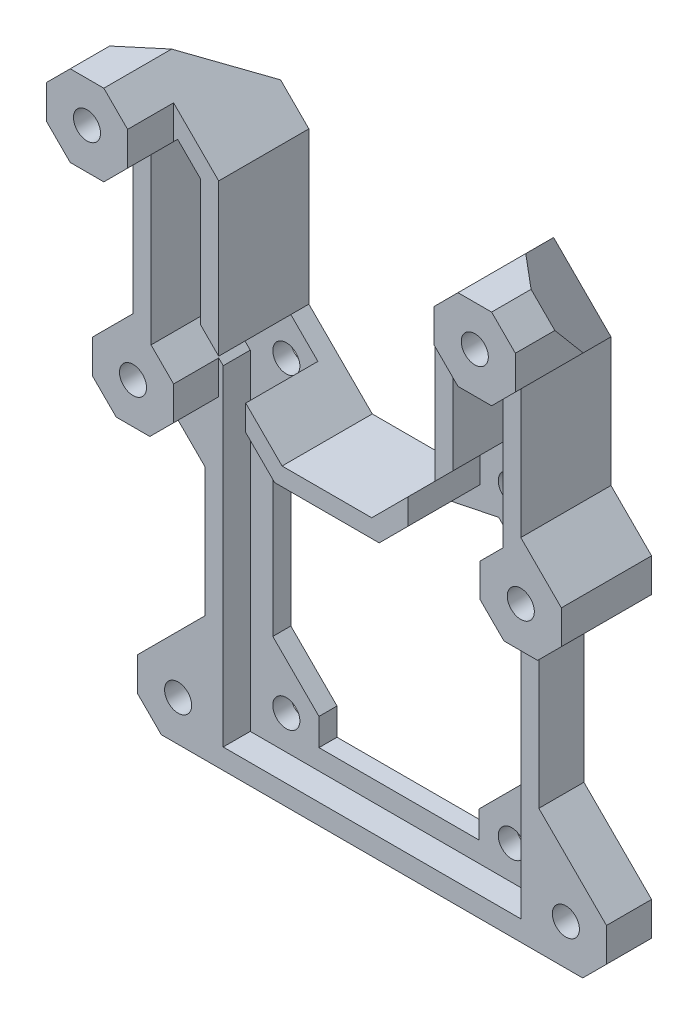
from build123d import *

# Parameters (mm, degrees)
SKETCH5_R           = 1.5
BOSS_EXTRUDE1_DEPTH = 2
SKETCH9_R           = 1.5
BOSS_EXTRUDE3_DEPTH = 3
SKETCH10_R          = 1.5
BOSS_EXTRUDE4_DEPTH = 5
BOSS_EXTRUDE5_DEPTH = 5.1
SKETCH13_R          = 1.5
CUT_EXTRUDE1_DEPTH  = 4.5
CUT_EXTRUDE2_DEPTH  = 7.5
CUT_EXTRUDE3_DEPTH  = 7.5
CHAMFER1_SIZE       = 1
CHAMFER1_SIZE2      = 1.191753593


with BuildPart() as part:
    # Sketch5 → Boss-Extrude1 (new body)
    with BuildSketch(Plane.XY):
        Polygon((19.636038969, -4.5), (-19.636038969, -4.5), (-23.363961031, -4.5), (-26, -1.863961031), (-26, 1.863961031), (-23.363961031, 4.5), (-18.5, 9.363961031), (-18.5, 23.636038969), (-23.363961031, 28.5), (-26, 31.136038969), (-26, 34.863961031), (-23.363961031, 37.5), (-21.5, 39.363961031), (-21.5, 53.636038969), (-23.363961031, 55.5), (-26, 58.136038969), (-26, 61.863961031), (-23.363961031, 64.5), (-19.636038969, 64.5), (-17, 61.863961031), (-12, 56.863961031), (-12, 40.029437252), (-11.050252532, 39.079689783), (-9, 37.029437252), (-4.970562748, 33), (4.970562748, 33), (9, 37.029437252), (11.050252532, 39.079689783), (12, 40.029437252), (12, 56.863961031), (17, 61.863961031), (19.636038969, 64.5), (23.363961031, 64.5), (26, 61.863961031), (26, 58.136038969), (23.363961031, 55.5), (21.5, 53.636038969), (21.5, 39.363961031), (23.363961031, 37.5), (26, 34.863961031), (26, 31.136038969), (23.363961031, 28.5), (18.5, 23.636038969), (18.5, 9.363961031), (23.363961031, 4.5), (26, 1.863961031), (26, -1.863961031), (23.363961031, -4.5), align=None)
        with Locations((-12.5, 35.579689783)):
            Circle(SKETCH5_R, mode=Mode.SUBTRACT)
        with Locations((-12.5, 1.5)):
            Circle(SKETCH5_R, mode=Mode.SUBTRACT)
        with Locations((12.5, 1.5)):
            Circle(SKETCH5_R, mode=Mode.SUBTRACT)
        with Locations((12.5, 35.579689783)):
            Circle(SKETCH5_R, mode=Mode.SUBTRACT)
        Polygon((-5.798989873, 31), (5.798989873, 31), (11.050252532, 32.079689783), (14, 29.129942315), (14, 8.121320344), (11, 5.121320344), (8.878679656, 3), (8.878679656, 0), (-8.878679656, 0), (-8.878679656, 3), (-11, 5.121320344), (-14, 8.121320344), (-14, 29.129942315), (-11.050252532, 32.079689783), align=None, mode=Mode.SUBTRACT)
    extrude(amount=BOSS_EXTRUDE1_DEPTH)

    # Sketch9 → Boss-Extrude3 (add)
    # profile 1 of 2: a face of its own
    with BuildSketch(Plane.XY.offset(2)):
        Polygon((19.636038969, -4.5), (-19.636038969, -4.5), (-23.363961031, -4.5), (-26, -1.863961031), (-26, 1.863961031), (-23.363961031, 4.5), (-18.5, 9.363961031), (-18.5, 23.636038969), (-23.363961031, 28.5), (-26, 31.136038969), (-26, 34.863961031), (-23.363961031, 37.5), (-21.5, 39.363961031), (-21.5, 53.636038969), (-23.363961031, 55.5), (-26, 58.136038969), (-26, 61.863961031), (-23.363961031, 64.5), (-19.636038969, 64.5), (-17, 61.863961031), (-12, 56.863961031), (-12, 40.029437252), (-14, 42.029437252), (-14, 56.035533906), (-16.550252532, 58.585786438), (-17, 58.136038969), (-19.5, 55.636038969), (-19.5, 37.363961031), (-17, 34.863961031), (-16.5, 34.363961031), (-16.5, -2.25), (16.5, -2.25), (16.5, 34.363961031), (17, 34.863961031), (19.5, 37.363961031), (19.5, 55.636038969), (17, 58.136038969), (16.550252532, 58.585786438), (14, 56.035533906), (14, 42.029437252), (12, 40.029437252), (12, 56.863961031), (17, 61.863961031), (19.636038969, 64.5), (23.363961031, 64.5), (26, 61.863961031), (26, 58.136038969), (23.363961031, 55.5), (21.5, 53.636038969), (21.5, 39.363961031), (23.363961031, 37.5), (26, 34.863961031), (26, 31.136038969), (23.363961031, 28.5), (18.5, 23.636038969), (18.5, 9.363961031), (23.363961031, 4.5), (26, 1.863961031), (26, -1.863961031), (23.363961031, -4.5), align=None)
        with Locations((-21.5, 0)):
            Circle(SKETCH9_R, mode=Mode.SUBTRACT)
        with Locations((-21.5, 33)):
            Circle(SKETCH9_R, mode=Mode.SUBTRACT)
        with Locations((21.5, 33)):
            Circle(SKETCH9_R, mode=Mode.SUBTRACT)
        with Locations((21.5, 0)):
            Circle(SKETCH9_R, mode=Mode.SUBTRACT)
    # profile 2 of 2: a face of its own
    with BuildSketch(Plane.XY.offset(2)):
        Polygon((4.970562748, 33), (-4.970562748, 33), (-9, 37.029437252), (-9, 34.201010127), (-5.798989873, 31), (5.798989873, 31), (9, 34.201010127), (9, 37.029437252), align=None)
    extrude(amount=BOSS_EXTRUDE3_DEPTH)

    # Sketch10 → Boss-Extrude4 (add)
    # profile 1 of 3: a face of its own
    with BuildSketch(Plane.XY.offset(5)):
        Polygon((-23.363961031, 28.5), (-19.636038969, 28.5), (-17, 31.136038969), (-17, 34.863961031), (-19.5, 37.363961031), (-19.5, 55.636038969), (-17, 58.136038969), (-16.550252532, 58.585786438), (-14, 56.035533906), (-14, 42.029437252), (-12, 40.029437252), (-12, 56.863961031), (-17, 61.863961031), (-19.636038969, 64.5), (-23.363961031, 64.5), (-26, 61.863961031), (-26, 58.136038969), (-23.363961031, 55.5), (-21.5, 53.636038969), (-21.5, 39.363961031), (-23.363961031, 37.5), (-26, 34.863961031), (-26, 31.136038969), align=None)
        with Locations((-21.5, 33)):
            Circle(SKETCH10_R, mode=Mode.SUBTRACT)
    # profile 2 of 3: a face of its own
    with BuildSketch(Plane.XY.offset(5)):
        Polygon((-9, 34.201010127), (-9, 37.029437252), (-4.970562748, 33), (4.970562748, 33), (9, 37.029437252), (9, 34.201010127), (5.798989873, 31), (-5.798989873, 31), align=None)
    # profile 3 of 3: a face of its own
    with BuildSketch(Plane.XY.offset(5)):
        Polygon((19.636038969, 28.5), (17, 31.136038969), (17, 34.863961031), (19.5, 37.363961031), (19.5, 55.636038969), (17, 58.136038969), (16.550252532, 58.585786438), (14, 56.035533906), (14, 42.029437252), (12, 40.029437252), (12, 56.863961031), (17, 61.863961031), (19.636038969, 64.5), (23.363961031, 64.5), (26, 61.863961031), (26, 58.136038969), (23.363961031, 55.5), (21.5, 53.636038969), (21.5, 39.363961031), (23.363961031, 37.5), (26, 34.863961031), (26, 31.136038969), (23.363961031, 28.5), align=None)
        with Locations((21.5, 33)):
            Circle(SKETCH10_R, mode=Mode.SUBTRACT)
    extrude(amount=BOSS_EXTRUDE4_DEPTH)

    # Sketch12 → Boss-Extrude5 (add)
    with BuildSketch(Plane.XY.offset(10)):
        Polygon((-26, 58.136038969), (-23.363961031, 55.5), (-19.636038969, 55.5), (-17, 58.136038969), (-17, 61.863961031), (-19.636038969, 64.5), (-23.363961031, 64.5), (-26, 61.863961031), align=None)
        Polygon((17, 58.136038969), (17, 61.863961031), (19.636038969, 64.5), (23.363961031, 64.5), (26, 61.863961031), (26, 58.136038969), (23.363961031, 55.5), (19.636038969, 55.5), align=None)
    extrude(amount=BOSS_EXTRUDE5_DEPTH)

    # Sketch13 → Cut-Extrude1 (cut)
    with BuildSketch(Plane.XY.offset(15.1)):
        with Locations((-21.5, 60)):
            Circle(SKETCH13_R)
        with Locations((21.5, 60)):
            Circle(SKETCH13_R)
    extrude(amount=-CUT_EXTRUDE1_DEPTH, mode=Mode.SUBTRACT)

    # Sketch15 → Cut-Extrude2 (cut, symmetric)
    with BuildSketch(Plane(origin=(19.25, 19.25, 0), x_dir=(0, 0, -1), z_dir=(0.7071067811865485, 0.7071067811865467, 0))):
        Polygon((0, 53.129202667), (-15.320888862, 65.98495486), (-8.893012766, 73.645399292), (6.427876097, 60.789647098), align=None)
    extrude(amount=CUT_EXTRUDE2_DEPTH, both=True, mode=Mode.SUBTRACT)

    # Sketch16 → Cut-Extrude3 (cut, symmetric)
    with BuildSketch(Plane(origin=(-19.25, 19.25, 0), x_dir=(0.7071067811865477, 0.7071067811865474, 0), z_dir=(-0.7071067811865474, 0.7071067811865477, 0))):
        Polygon((53.129202667, 0), (65.98495486, -15.320888862), (73.645399292, -8.893012766), (60.789647098, 6.427876097), align=None)
    extrude(amount=CUT_EXTRUDE3_DEPTH, both=True, mode=Mode.SUBTRACT)

    # Chamfer1
    chamfer1_edges = [part.edges().sort_by_distance(p)[0] for p in [
        (-18.025126266, 57.110912703, 2),
        (18.025126266, 57.110912703, 2),
    ]]
    chamfer1_side = [part.faces().sort_by_distance(p)[0] for p in [
        (-13.510979105, 40.518458147, 2),
    ]]
    chamfer(chamfer1_edges, length=CHAMFER1_SIZE, length2=CHAMFER1_SIZE2, reference=chamfer1_side[0])


solid = part.part
